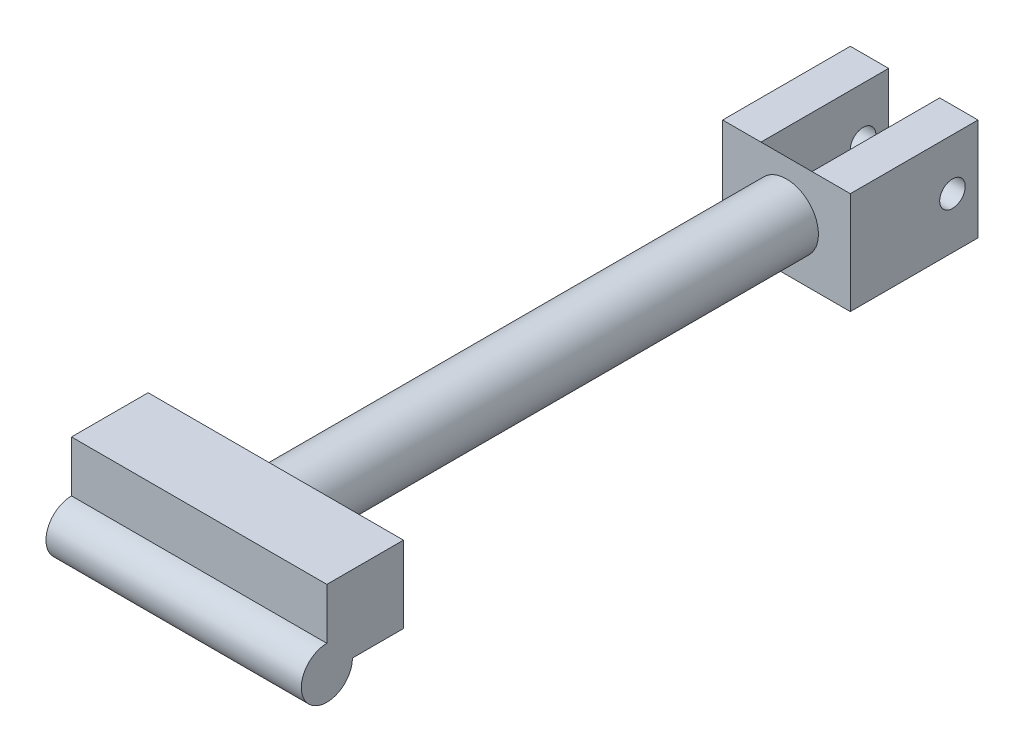
from build123d import *

# Parameters (mm, degrees)
SKIZZE1_W                       = 100
SKIZZE1_H                       = 30
AUFSATZ_LINEAR_AUSTRAGEN1_DEPTH = 30
SKIZZE2_R                       = 10
AUFSATZ_LINEAR_AUSTRAGEN2_DEPTH = 100
SKIZZE3_R                       = 12.5
AUFSATZ_LINEAR_AUSTRAGEN3_DEPTH = 200
SKIZZE4_W                       = 50
SKIZZE4_H                       = 40
AUFSATZ_LINEAR_AUSTRAGEN4_DEPTH = 50
SKIZZE6_W                       = 20
SKIZZE6_H                       = 70
SCHNITT_LINEAR_AUSTRAGEN2_DEPTH = 35
FASE1_SIZE                      = 15
SKIZZE7_R                       = 5
SCHNITT_LINEAR_AUSTRAGEN3_DEPTH = 54


with BuildPart() as part:
    # Skizze1 → Aufsatz-Linear austragen1 (new body)
    with BuildSketch(Plane(origin=(0, 0, 0), x_dir=(1, 0, 0), z_dir=(0, 1, 0))):
        Rectangle(SKIZZE1_W, SKIZZE1_H)
    extrude(amount=AUFSATZ_LINEAR_AUSTRAGEN1_DEPTH)

    # Skizze2 → Aufsatz-Linear austragen2 (add)
    with BuildSketch(Plane(origin=(50, 0, 0), x_dir=(0, 0, -1), z_dir=(1, 0, 0))):
        with Locations((-15, 0)):
            Circle(SKIZZE2_R)
    extrude(amount=-AUFSATZ_LINEAR_AUSTRAGEN2_DEPTH)

    # Skizze3 → Aufsatz-Linear austragen3 (add)
    with BuildSketch(Plane(origin=(0, 0, -15), x_dir=(-1, 0, 0), z_dir=(0, 0, -1))):
        with Locations(Location((0, 15, 0), (0, 0, 180))):
            Circle(SKIZZE3_R)
    extrude(amount=AUFSATZ_LINEAR_AUSTRAGEN3_DEPTH)

    # Skizze4 → Aufsatz-Linear austragen4 (add)
    with BuildSketch(Plane(origin=(0, 0, -215), x_dir=(-1, 0, 0), z_dir=(0, 0, -1))):
        with Locations((0, 15)):
            Rectangle(SKIZZE4_W, SKIZZE4_H)
    extrude(amount=AUFSATZ_LINEAR_AUSTRAGEN4_DEPTH)

    # Skizze6 → Schnitt-Linear austragen2 (cut)
    with BuildSketch(Plane(origin=(0, 0, -265), x_dir=(-1, 0, 0), z_dir=(0, 0, -1))):
        Rectangle(SKIZZE6_W, SKIZZE6_H)
    extrude(amount=-SCHNITT_LINEAR_AUSTRAGEN2_DEPTH, mode=Mode.SUBTRACT)

    # Fase1
    fase1_edges = [part.edges().sort_by_distance(p)[0] for p in [
        (0, -5, -230),
        (0, 35, -230),
    ]]
    chamfer(fase1_edges, length=FASE1_SIZE - 0.0001)  # a hair under: the kernel refuses the full size

    # Skizze7 → Schnitt-Linear austragen3 (cut)
    with BuildSketch(Plane(origin=(25, 0, 0), x_dir=(0, 0, -1), z_dir=(1, 0, 0))):
        with Locations(Location((255, 15, 0), (0, 0, 90))):
            Circle(SKIZZE7_R)
    extrude(amount=-SCHNITT_LINEAR_AUSTRAGEN3_DEPTH, mode=Mode.SUBTRACT)


solid = part.part
